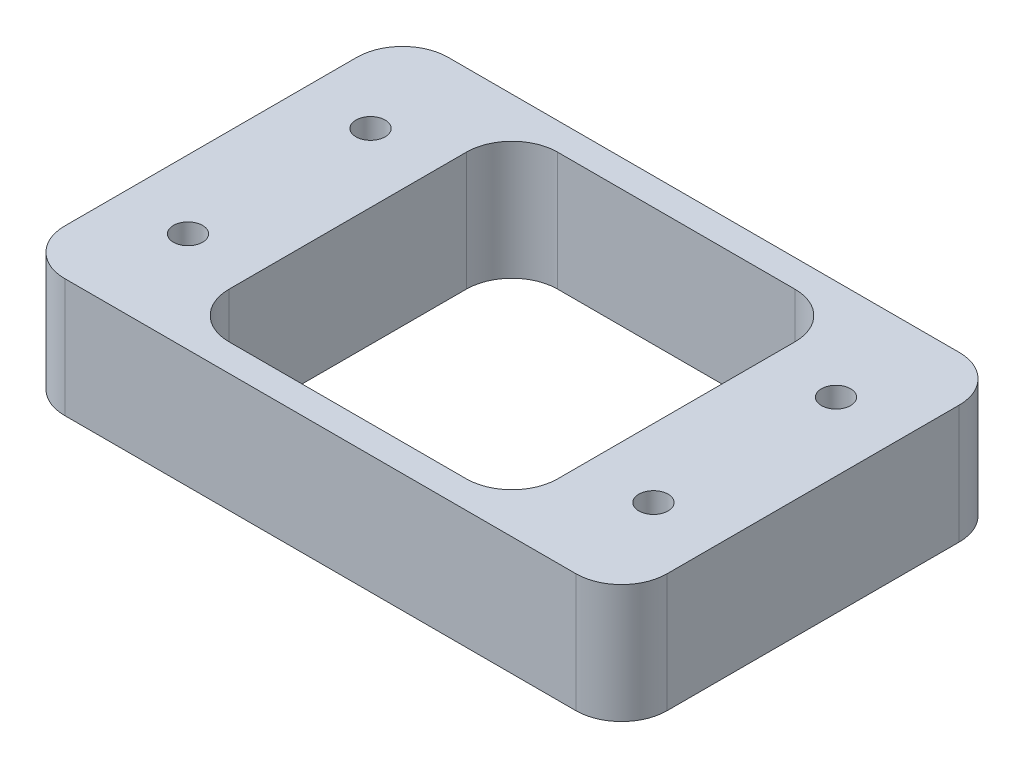
from build123d import *

# Parameters (mm, degrees)
SKETCH1_W           = 66
SKETCH1_H           = 42
SKETCH1_R           = 1.6
BOSS_EXTRUDE1_DEPTH = 13
SKETCH2_W           = 36
SKETCH2_H           = 36
CUT_EXTRUDE1_DEPTH  = 80.303215572
FILLET1_R           = 5


with BuildPart() as part:
    # Sketch1 → Boss-Extrude1 (new body)
    with BuildSketch(Plane(origin=(0, 0, 0), x_dir=(1, 0, 0), z_dir=(0, 1, 0))):
        with Locations((33, 21)):
            Rectangle(SKETCH1_W, SKETCH1_H)
        with Locations((7.5, 31)):
            Circle(SKETCH1_R, mode=Mode.SUBTRACT)
        with Locations((7.5, 11)):
            Circle(SKETCH1_R, mode=Mode.SUBTRACT)
        with Locations((58.5, 11)):
            Circle(SKETCH1_R, mode=Mode.SUBTRACT)
        with Locations((58.5, 31)):
            Circle(SKETCH1_R, mode=Mode.SUBTRACT)
    extrude(amount=BOSS_EXTRUDE1_DEPTH)

    # Sketch2 → Cut-Extrude1 (cut, through all)
    with BuildSketch(Plane(origin=(0, 13, 0), x_dir=(1, 0, 0), z_dir=(0, 1, 0))):
        with Locations((33, 21)):
            Rectangle(SKETCH2_W, SKETCH2_H)
    extrude(amount=-CUT_EXTRUDE1_DEPTH, mode=Mode.SUBTRACT)

    # Fillet1
    fillet1_edges = [part.edges().sort_by_distance(p)[0] for p in [
        (0, 6.5, -42),
        (66, 6.5, -42),
        (66, 6.5, 0),
        (0, 6.5, 0),
        (51, 6.5, -3),
        (15, 6.5, -39),
        (51, 6.5, -39),
        (15, 6.5, -3),
    ]]
    fillet(fillet1_edges, radius=FILLET1_R)


solid = part.part
